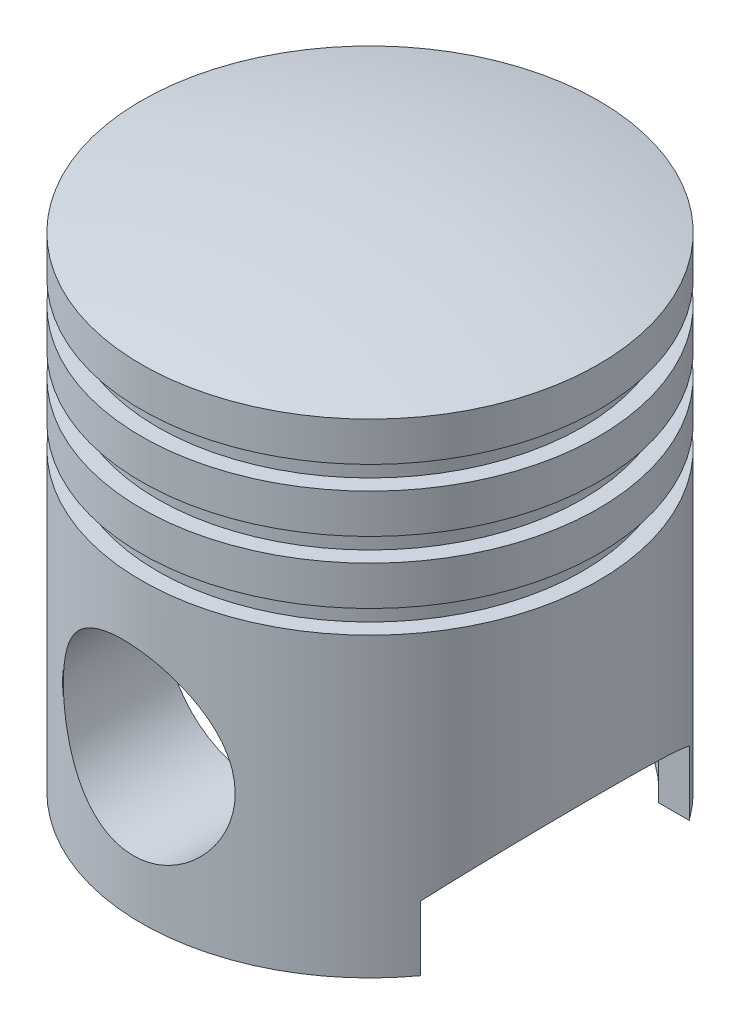
from build123d import *

# Parameters (mm, degrees)
KUBBE1_FACE_RADIUS          = 42.5
KUBBE1_HEIGHT               = 5
KES_EKSTR_ZYON1_DEPTH       = 113.41663578
KES_EKSTR_ZYON1_DEPTH_BACK  = 113.41663578
IZIM2_R                     = 16.9
IZIM3_R                     = 38
KES_EKSTR_ZYON3_DEPTH       = 85
KES_EKSTR_ZYON4_DEPTH       = 113.416635855
KES_EKSTR_ZYON4_DEPTH_BACK  = 113.416635855
Y_KSEKLIK_EKSTR_ZYON1_START = 19
IZIM5_R                     = 22.5
Y_KSEKLIK_EKSTR_ZYON1_DEPTH = 19
Y_KSEKLIK_EKSTR_ZYON1_TAPER = 16
Y_KSEKLIK_EKSTR_ZYON2_START = -19
IZIM9_R                     = 22.5
Y_KSEKLIK_EKSTR_ZYON2_DEPTH = 19
Y_KSEKLIK_EKSTR_ZYON2_DRAFT = -16
KES_EKSTR_ZYON6_DEPTH       = 132.573173651
KES_EKSTR_ZYON6_DEPTH_BACK  = 132.573173651
IZIM10_R                    = 16.9


with BuildPart() as part:
    # Çizim1 → Döndür1 (revolve)
    with BuildSketch(Plane.XY, mode=Mode.PRIVATE) as d_nd_r1_sk:
        Polygon((0, 0), (0, 90), (42.5, 90), (42.5, 82.7), (39.5, 82.7), (39.5, 78.4), (42.5, 78.4), (42.5, 71.1), (39.5, 71.1), (39.5, 66.8), (42.5, 66.8), (42.5, 59.5), (39.5, 59.5), (39.5, 55.2), (42.5, 55.2), (42.5, 0), align=None)
    revolve(d_nd_r1_sk.sketch.rotate(Axis((0, 0, 0), (0, 1, 0)), 90), axis=Axis((0, 0, 0), (0, 1, 0)))

    # Kubbe1: a dome of height H over a round flat face of radius A is a cap of a sphere of radius (A * A + H * H) / (2 * H)
    kubbe1_r = (KUBBE1_FACE_RADIUS * KUBBE1_FACE_RADIUS + KUBBE1_HEIGHT * KUBBE1_HEIGHT) / (2 * KUBBE1_HEIGHT)
    kubbe1_base = Plane((0, 90, 0), z_dir=(0, 1, 0))
    with Locations(kubbe1_base.offset(KUBBE1_HEIGHT - kubbe1_r)):
        kubbe1_ball = Sphere(kubbe1_r, mode=Mode.PRIVATE)
    add(split(kubbe1_ball, bisect_by=kubbe1_base, keep=Keep.TOP, mode=Mode.PRIVATE))

    # Çizim2 → Kes-Ekstrüzyon1 (cut, two sides: drawn at the far end of the back side and taken through both)
    with BuildSketch(Plane.XY.offset(-KES_EKSTR_ZYON1_DEPTH_BACK)):
        with Locations((-2.119743269, 27)):
            Circle(IZIM2_R)
    extrude(amount=KES_EKSTR_ZYON1_DEPTH + KES_EKSTR_ZYON1_DEPTH_BACK, mode=Mode.SUBTRACT)

    # Çizim3 → Kes-Ekstrüzyon3 (cut)
    with BuildSketch(Plane(origin=(0, 0, 0), x_dir=(-1, 0, 0), z_dir=(0, -1, 0))):
        with Locations(Location((0, 0, 0), (0, 0, 90))):
            Circle(IZIM3_R)
    extrude(amount=-KES_EKSTR_ZYON3_DEPTH, mode=Mode.SUBTRACT)

    # Çizim4 → Kes-Ekstrüzyon4 (cut, two sides: drawn at the far end of the back side and taken through both)
    with BuildSketch(Plane(origin=(0, 0, 0), x_dir=(0, 0, -1), z_dir=(1, 0, 0)).offset(-KES_EKSTR_ZYON4_DEPTH_BACK)):
        with BuildLine():
            Line((-25, 0), (-25, 12))
            ThreePointArc((-25, 12), (0, 20.775010008), (25, 12))
            Line((25, 12), (25, 0))
            Line((25, 0), (-25, 0))
        make_face()
    extrude(amount=KES_EKSTR_ZYON4_DEPTH + KES_EKSTR_ZYON4_DEPTH_BACK, mode=Mode.SUBTRACT)

    # Çizim5 → Yükseklik-Ekstrüzyon1 (add)
    with BuildSketch(Plane.XY.offset(Y_KSEKLIK_EKSTR_ZYON1_START)):
        with Locations((-2.119743269, 27)):
            Circle(IZIM5_R)
    extrude(amount=Y_KSEKLIK_EKSTR_ZYON1_DEPTH, taper=Y_KSEKLIK_EKSTR_ZYON1_TAPER)


with BuildPart() as y_kseklik_ekstr_zyon2_tool:
    # Çizim9 → Yükseklik-Ekstrüzyon2 (with draft: the straight prism first)
    with BuildSketch(Plane.XY.offset(Y_KSEKLIK_EKSTR_ZYON2_START)):
        with Locations((-2.119743269, 27)):
            Circle(IZIM9_R)
    extrude(amount=-Y_KSEKLIK_EKSTR_ZYON2_DEPTH)
    # Yükseklik-Ekstrüzyon2: the draft: its side faces are tilted about the plane it starts from
    y_kseklik_ekstr_zyon2_sides = [y_kseklik_ekstr_zyon2_tool.faces().sort_by_distance(p)[0] for p in [
        (-24.619743269, 27, -28.5),
    ]]
    draft(y_kseklik_ekstr_zyon2_sides, Plane.XY.offset(Y_KSEKLIK_EKSTR_ZYON2_START), Y_KSEKLIK_EKSTR_ZYON2_DRAFT)


with BuildPart() as part_1:
    add(part.part)

    # Yükseklik-Ekstrüzyon2: add y_kseklik_ekstr_zyon2_tool
    add(y_kseklik_ekstr_zyon2_tool.part)

    # Çizim10 → Kes-Ekstrüzyon6 (cut, two sides: drawn at the far end of the back side and taken through both)
    with BuildSketch(Plane(origin=(0, 0, -38), x_dir=(-1, 0, 0), z_dir=(0, 0, -1)).offset(-KES_EKSTR_ZYON6_DEPTH_BACK)):
        with Locations(Location((2.119743269, 27, 0), (0, 0, 180))):
            Circle(IZIM10_R)
    extrude(amount=KES_EKSTR_ZYON6_DEPTH + KES_EKSTR_ZYON6_DEPTH_BACK, mode=Mode.SUBTRACT)


solid = part_1.part
